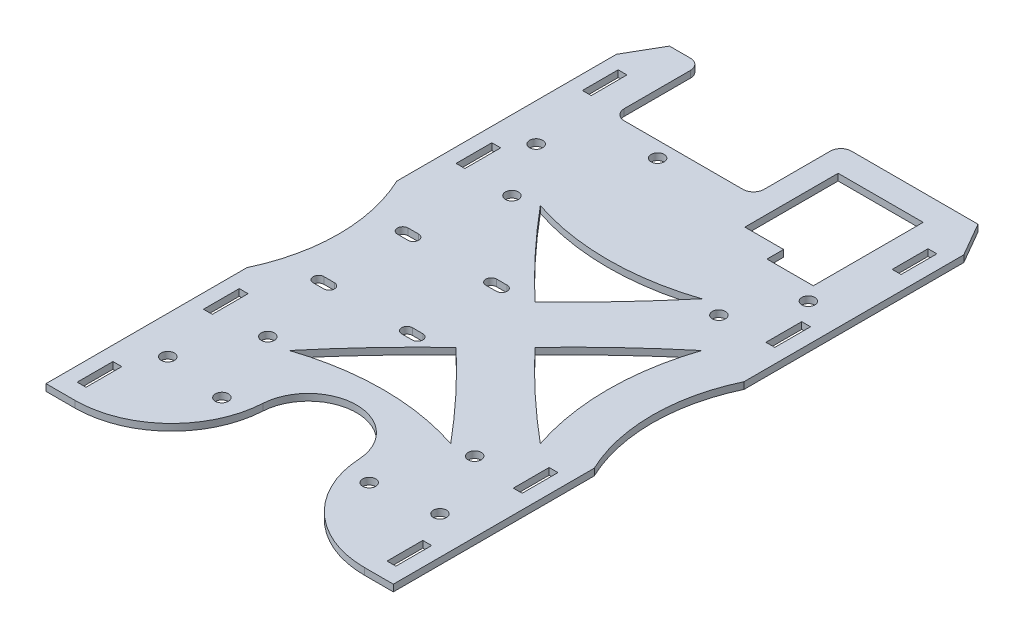
from build123d import *

# Parameters (mm, degrees)
SKETCH1_W              = 2.1
SKETCH1_H              = 8.5
SKETCH1_R              = 1.55
EXTRUDE_2836_DEPTH     = 1.6
SKETCH_1_W             = 33.213467336
SKETCH_1_H             = 20.75
CUT_EXTRUDE_3132_DEPTH = 98.639296877
CUT_EXTRUDE_3472_DEPTH = 98.639296877
CUT_EXTRUDE_3745_DEPTH = 10
FILLET_1_R             = 2.5


with BuildPart() as part:
    # Sketch1 → Extrude 2836 (new body)
    with BuildSketch(Plane(origin=(0, 0, 0), x_dir=(1, 0, 0), z_dir=(0, 1, 0))):
        with BuildLine():
            Line((-41.25, 0), (-41.25, -55))
            Line((-41.25, -55), (-34.369560329, -55))
            ThreePointArc((-34.369560329, -55), (-18.59120626, -48.721265785), (-11.440696816, -33.31837076))
            ThreePointArc((-11.440696816, -33.31837076), (-7.872843983, -25.632867641), (0, -22.5))
            ThreePointArc((0, -22.5), (7.872843983, -25.632867641), (11.440696816, -33.31837076))
            ThreePointArc((11.440696816, -33.31837076), (18.59120626, -48.721265785), (34.369560329, -55))
            Line((34.369560329, -55), (41.25, -55))
            Line((41.25, -55), (41.25, 0))
            Line((41.25, 0), (41.25, 80.5))
            Line((41.25, 80.5), (36.640789302, 88.483387111))
            Line((36.640789302, 88.483387111), (-36.640789302, 88.483387111))
            Line((-36.640789302, 88.483387111), (-41.25, 80.5))
            Line((-41.25, 80.5), (-41.25, 0))
        make_face()
        with Locations((-36.8, -46.75)):
            Rectangle(SKETCH1_W, SKETCH1_H, mode=Mode.SUBTRACT)
        with Locations((-32.325, -35)):
            Circle(SKETCH1_R, mode=Mode.SUBTRACT)
        with Locations((-17.5, -36.97765453)):
            Circle(SKETCH1_R, mode=Mode.SUBTRACT)
        with Locations((-36.8, -16.75)):
            Rectangle(SKETCH1_W, SKETCH1_H, mode=Mode.SUBTRACT)
        with Locations((-24.575, -19)):
            Circle(SKETCH1_R, mode=Mode.SUBTRACT)
        with Locations((17.5, -36.97765453)):
            Circle(SKETCH1_R, mode=Mode.SUBTRACT)
        with Locations((36.8, -46.75)):
            Rectangle(SKETCH1_W, SKETCH1_H, mode=Mode.SUBTRACT)
        with Locations((32.325, -35)):
            Circle(SKETCH1_R, mode=Mode.SUBTRACT)
        with Locations((24.575, -19)):
            Circle(SKETCH1_R, mode=Mode.SUBTRACT)
        with Locations((36.8, -16.75)):
            Rectangle(SKETCH1_W, SKETCH1_H, mode=Mode.SUBTRACT)
        with Locations((-36.8, 43.25)):
            Rectangle(SKETCH1_W, SKETCH1_H, mode=Mode.SUBTRACT)
        with Locations((-32.325, 52.5)):
            Circle(SKETCH1_R, mode=Mode.SUBTRACT)
        with Locations((-24.575, 39)):
            Circle(SKETCH1_R, mode=Mode.SUBTRACT)
        with Locations((-36.8, 73.25)):
            Rectangle(SKETCH1_W, SKETCH1_H, mode=Mode.SUBTRACT)
        with Locations((-15.000000144, 64.02234547)):
            Circle(SKETCH1_R, mode=Mode.SUBTRACT)
        with Locations((24.575, 39)):
            Circle(SKETCH1_R, mode=Mode.SUBTRACT)
        with Locations((36.8, 43.25)):
            Rectangle(SKETCH1_W, SKETCH1_H, mode=Mode.SUBTRACT)
        with Locations((32.325, 52.5)):
            Circle(SKETCH1_R, mode=Mode.SUBTRACT)
        Polygon((9.55, 60.2), (9.55, 82.35), (29.75, 82.35), (29.75, 56.25), (18.75, 56.25), (18.75, 60.2), align=None, mode=Mode.SUBTRACT)
        with Locations((36.8, 73.25)):
            Rectangle(SKETCH1_W, SKETCH1_H, mode=Mode.SUBTRACT)
    extrude(amount=EXTRUDE_2836_DEPTH)

    # 外部切除点示意-1 → Cut-Extrude 3132 (cut, through all)
    with BuildSketch(Plane(origin=(0, 0, 0), x_dir=(1, 0, 0), z_dir=(0, 1, 0))):
        with BuildLine():
            Line((-41.25, 28.319513771), (-41.285942601, -7.350545872))
            ThreePointArc((-41.285942601, -7.350545872), (-37.250021115, 10.480435299), (-41.25, 28.319513771))
        make_face()
        with BuildLine():
            Line((41.25, 28.319513771), (41.285942601, -7.350545872))
            ThreePointArc((41.285942601, -7.350545872), (37.250021115, 10.480435299), (41.25, 28.319513771))
        make_face()
        with Locations((-12.540081807, 78.108387111)):
            Rectangle(SKETCH_1_W, SKETCH_1_H)
    extrude(amount=CUT_EXTRUDE_3132_DEPTH, mode=Mode.SUBTRACT)

    # Sketch 3178 → Cut-Extrude 3472 (cut, through all)
    with BuildSketch(Plane(origin=(0, 0, 0), x_dir=(1, 0, 0), z_dir=(0, 1, 0))):
        with BuildLine():
            Line((-30.25, 20.025), (-27.75, 20.025))
            ThreePointArc((-27.75, 20.025), (-26.475, 18.75), (-27.75, 17.475))
            Line((-27.75, 17.475), (-30.25, 17.475))
            ThreePointArc((-30.25, 17.475), (-31.525, 18.75), (-30.25, 20.025))
        make_face()
        with BuildLine():
            Line((-6.75, 20.025), (-9.25, 20.025))
            ThreePointArc((-9.25, 20.025), (-10.525, 18.75), (-9.25, 17.475))
            Line((-9.25, 17.475), (-6.75, 17.475))
            ThreePointArc((-6.75, 17.475), (-5.475, 18.75), (-6.75, 20.025))
        make_face()
        with BuildLine():
            Line((-30.25, -2.525), (-27.75, -2.525))
            ThreePointArc((-27.75, -2.525), (-26.475, -1.25), (-27.75, 0.025))
            Line((-27.75, 0.025), (-30.25, 0.025))
            ThreePointArc((-30.25, 0.025), (-31.525, -1.25), (-30.25, -2.525))
        make_face()
        with BuildLine():
            Line((-6.75, -2.525), (-9.25, -2.525))
            ThreePointArc((-9.25, -2.525), (-10.525, -1.25), (-9.25, 0.025))
            Line((-9.25, 0.025), (-6.75, 0.025))
            ThreePointArc((-6.75, 0.025), (-5.475, -1.25), (-6.75, -2.525))
        make_face()
    extrude(amount=CUT_EXTRUDE_3472_DEPTH, mode=Mode.SUBTRACT)

    # 草图2 → Cut-Extrude 3745 (cut)
    with BuildSketch(Plane(origin=(0, 1.6, 0), x_dir=(1, 0, 0), z_dir=(0, 1, 0))):
        with BuildLine():
            ThreePointArc((9.371867176, 10.52234547), (19.323145451, 20.402758988), (29.820182402, 29.701292521))
            ThreePointArc((29.820182402, 29.701292521), (26.696086154, 10.52234547), (29.820182402, -8.65660158))
            ThreePointArc((29.820182402, -8.65660158), (19.323145451, 0.641931952), (9.371867176, 10.52234547))
        make_face()
        with BuildLine():
            ThreePointArc((0, 1.150478295), (9.880413518, -8.800799981), (19.178947051, -19.297836932))
            ThreePointArc((19.178947051, -19.297836932), (0, -16.173740684), (-19.178947051, -19.297836932))
            ThreePointArc((-19.178947051, -19.297836932), (-9.880413518, -8.800799981), (0, 1.150478295))
        make_face()
        with BuildLine():
            ThreePointArc((0, 19.894212646), (-9.880413518, 29.845490922), (-19.178947051, 40.342527872))
            ThreePointArc((-19.178947051, 40.342527872), (0, 37.218431624), (19.178947051, 40.342527872))
            ThreePointArc((19.178947051, 40.342527872), (9.880413518, 29.845490922), (0, 19.894212646))
        make_face()
    extrude(amount=-CUT_EXTRUDE_3745_DEPTH, mode=Mode.SUBTRACT)

    # 圆角1
    fillet_1_edges = [part.edges().sort_by_distance(p)[0] for p in [
        (-29.146815475, 0.8, -67.733387111),
        (4.066651861, 0.8, -67.733387111),
        (4.066651861, 0.8, -88.483387111),
        (-29.146815475, 0.8, -88.483387111),
    ]]
    fillet(fillet_1_edges, radius=FILLET_1_R)


solid = part.part
